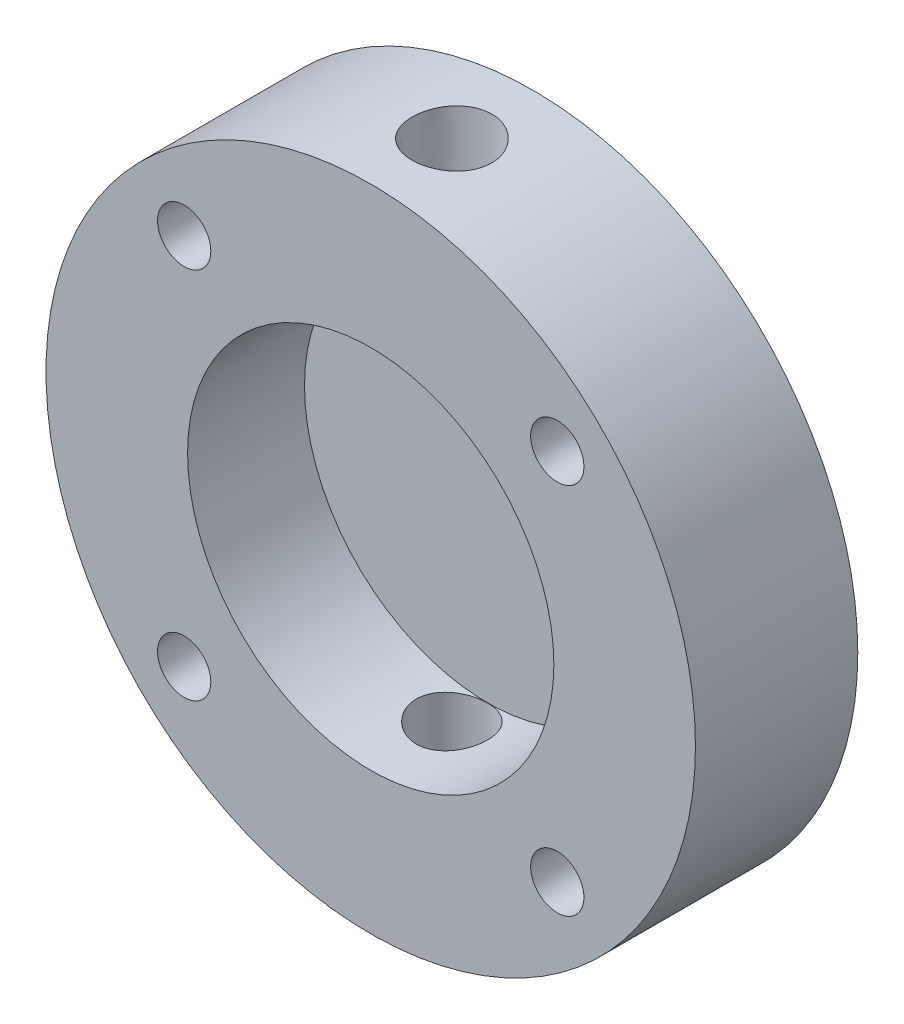
from build123d import *

# Parameters (mm, degrees)
SKETCH1_R           = 50.8
SKETCH1_R_2         = 4.1671875
BOSS_EXTRUDE1_DEPTH = 25.4
SKETCH2_R           = 28.6512
CUT_EXTRUDE1_DEPTH  = 18.288


# Read off the part's stored shape, not the designer's step: 1/4 NPT Tapped Hole1
with BuildPart() as part:
    # Sketch1 → Boss-Extrude1 (new body)
    with BuildSketch(Plane.XY):
        Circle(SKETCH1_R)
        with Locations((-29.185832393, 29.185832393)):
            Circle(SKETCH1_R_2, mode=Mode.SUBTRACT)
        with Locations((-29.185832393, -29.185832393)):
            Circle(SKETCH1_R_2, mode=Mode.SUBTRACT)
        with Locations((29.185832393, -29.185832393)):
            Circle(SKETCH1_R_2, mode=Mode.SUBTRACT)
        with Locations((29.185832393, 29.185832393)):
            Circle(SKETCH1_R_2, mode=Mode.SUBTRACT)
    extrude(amount=BOSS_EXTRUDE1_DEPTH)

    # Sketch2 → Cut-Extrude1 (cut)
    with BuildSketch(Plane.XY.offset(25.4)):
        Circle(SKETCH2_R)
    extrude(amount=-CUT_EXTRUDE1_DEPTH, mode=Mode.SUBTRACT)

    # 1/4 NPT Tapped Hole1 outline → 1/4 NPT Tapped Hole1 (revolve, cut)
    with BuildSketch(Plane.XY.offset(12.7)):
        Polygon((6.24028647, -50.800059108), (5.943685794, -40.894), (5.5626, -40.894), (5.5626, -28.105874104), (0, -28.105874104), (0, -50.800059108), align=None)
        Polygon((0, 28.105874104), (5.5626, 28.105874104), (5.5626, 40.894), (5.943685794, 40.894), (6.2402863, 50.800053431), (0, 50.800053431), align=None)
    revolve(axis=Axis((0, 0, 12.7), (0, 1, 0)), mode=Mode.SUBTRACT)


solid = part.part
